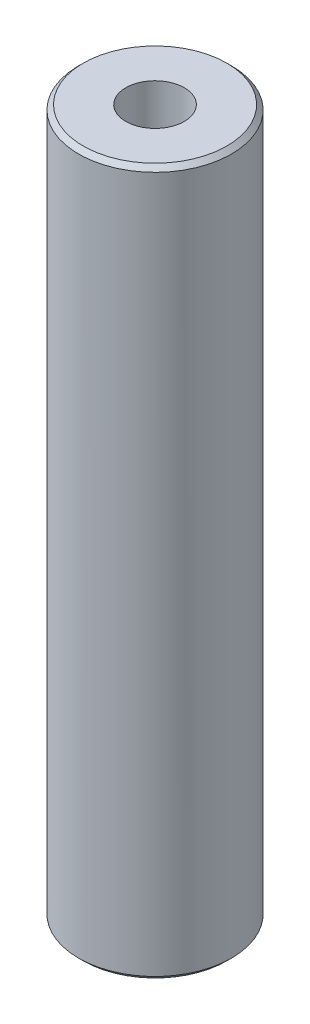
from build123d import *

# Parameters (mm, degrees)
SKETCH1_R           = 40
BOSS_EXTRUDE1_DEPTH = 369.199846226
SKETCH2_R           = 15.301985822
CUT_EXTRUDE1_DEPTH  = 374.508402118
CHAMFER1_SIZE       = 2.420573605


with BuildPart() as part:
    # Sketch1 → Boss-Extrude1 (new body)
    with BuildSketch(Plane(origin=(0, 0, 0), x_dir=(1, 0, 0), z_dir=(0, 1, 0))):
        Circle(SKETCH1_R)
    extrude(amount=BOSS_EXTRUDE1_DEPTH)

    # Sketch2 → Cut-Extrude1 (cut, through all)
    with BuildSketch(Plane(origin=(0, 0, 0), x_dir=(1, 0, 0), z_dir=(0, 1, 0))):
        Circle(SKETCH2_R)
    extrude(amount=CUT_EXTRUDE1_DEPTH, mode=Mode.SUBTRACT)

    # Chamfer1
    chamfer1_edges = [part.edges().sort_by_distance(p)[0] for p in [
        (-40, 369.199846226, 0),
        (-40, 0, 0),
    ]]
    chamfer(chamfer1_edges, length=CHAMFER1_SIZE)


solid = part.part
